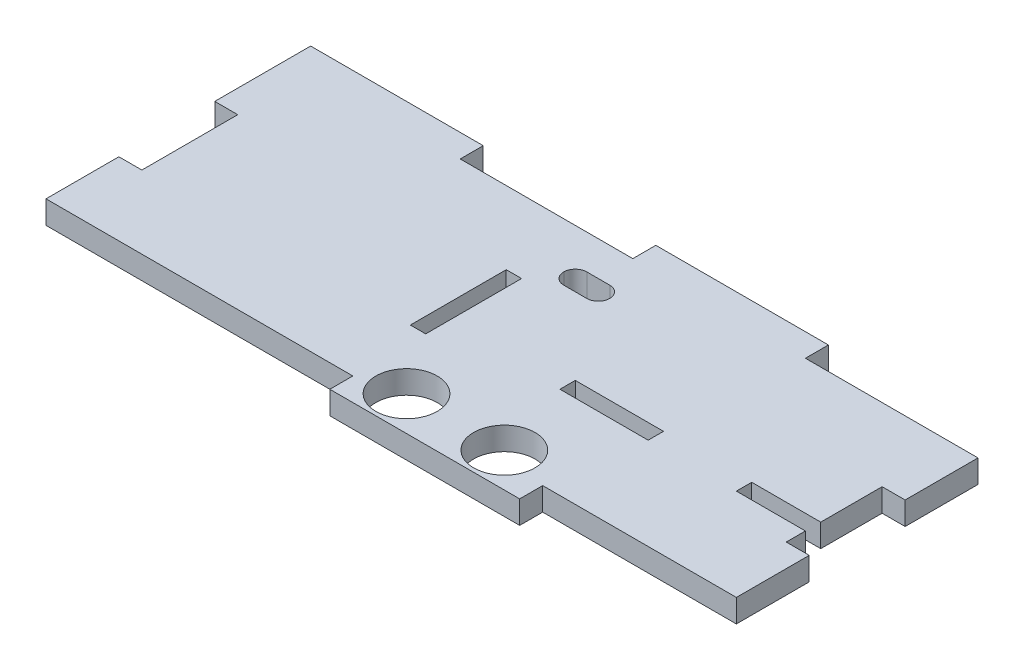
from build123d import *

# Parameters (mm, degrees)
SKETCH1_W           = 180
SKETCH1_H           = 75
BOSS_EXTRUDE1_DEPTH = 6
SKETCH2_W           = 23
SKETCH2_H           = 4
SKETCH2_W_2         = 24
SKETCH2_W_3         = 4
SKETCH2_H_2         = 25
CUT_EXTRUDE1_DEPTH  = 6
SKETCH3_R           = 8
SKETCH3_W           = 12
SKETCH3_H           = 6
CUT_EXTRUDE5_DEPTH  = 196.092285855
FILLET1_R           = 3
SKETCH4_W           = 44.5
SKETCH4_H           = 6
SKETCH4_W_2         = 6
SKETCH4_H_2         = 5
SKETCH4_H_3         = 16
SKETCH4_H_4         = 25
SKETCH4_W_3         = 74
SKETCH4_W_4         = 45
CUT_EXTRUDE6_DEPTH  = 196.092285855


with BuildPart() as part:
    # Sketch1 → Boss-Extrude1 (new body)
    with BuildSketch(Plane(origin=(0, 0, 0), x_dir=(1, 0, 0), z_dir=(0, 1, 0))):
        with Locations((90, 37.5)):
            Rectangle(SKETCH1_W, SKETCH1_H)
    extrude(amount=BOSS_EXTRUDE1_DEPTH)

    # Sketch2 → Cut-Extrude1 (cut)
    with BuildSketch(Plane(origin=(0, 6, 0), x_dir=(1, 0, 0), z_dir=(0, 1, 0))):
        with Locations((121.5, 32)):
            Rectangle(SKETCH2_W, SKETCH2_H)
        with Locations((168, 32)):
            Rectangle(SKETCH2_W_2, SKETCH2_H)
        with Locations((78, 37.5)):
            Rectangle(SKETCH2_W_3, SKETCH2_H_2)
    extrude(amount=-CUT_EXTRUDE1_DEPTH, mode=Mode.SUBTRACT)

    # Sketch3 → Cut-Extrude5 (cut, through all)
    with BuildSketch(Plane(origin=(0, 6, 0), x_dir=(1, 0, 0), z_dir=(0, 1, 0))):
        with Locations(Location((91, 9, 0), (0, 0, 270))):
            Circle(SKETCH3_R)
        with Locations(Location((116.5, 9, 0), (0, 0, 270))):
            Circle(SKETCH3_R)
        with Locations((90, 57)):
            Rectangle(SKETCH3_W, SKETCH3_H)
    extrude(amount=-CUT_EXTRUDE5_DEPTH, mode=Mode.SUBTRACT)

    # Fillet1
    fillet1_edges = [part.edges().sort_by_distance(p)[0] for p in [
        (96, 3, -54),
        (96, 3, -60),
        (84, 3, -54),
        (84, 3, -60),
    ]]
    fillet(fillet1_edges, radius=FILLET1_R - 0.0001)  # a hair under: the kernel refuses the full size

    # Sketch4 → Cut-Extrude6 (cut, through all)
    with BuildSketch(Plane(origin=(0, 6, 0), x_dir=(1, 0, 0), z_dir=(0, 1, 0))):
        with Locations((151.75, 3)):
            Rectangle(SKETCH4_W, SKETCH4_H)
        with Locations((177, 3)):
            Rectangle(SKETCH4_W_2, SKETCH4_H)
        with Locations((177, 27.5)):
            Rectangle(SKETCH4_W_2, SKETCH4_H_2)
        with Locations((177, 42)):
            Rectangle(SKETCH4_W_2, SKETCH4_H_3)
        with Locations((3, 37.5)):
            Rectangle(SKETCH4_W_2, SKETCH4_H_4)
        with Locations((3, 3)):
            Rectangle(SKETCH4_W_2, SKETCH4_H)
        with Locations((43, 3)):
            Rectangle(SKETCH4_W_3, SKETCH4_H)
        with Locations((157.5, 72)):
            Rectangle(SKETCH4_W_4, SKETCH4_H)
        with Locations((67.5, 72)):
            Rectangle(SKETCH4_W_4, SKETCH4_H)
    extrude(amount=-CUT_EXTRUDE6_DEPTH, mode=Mode.SUBTRACT)


solid = part.part
